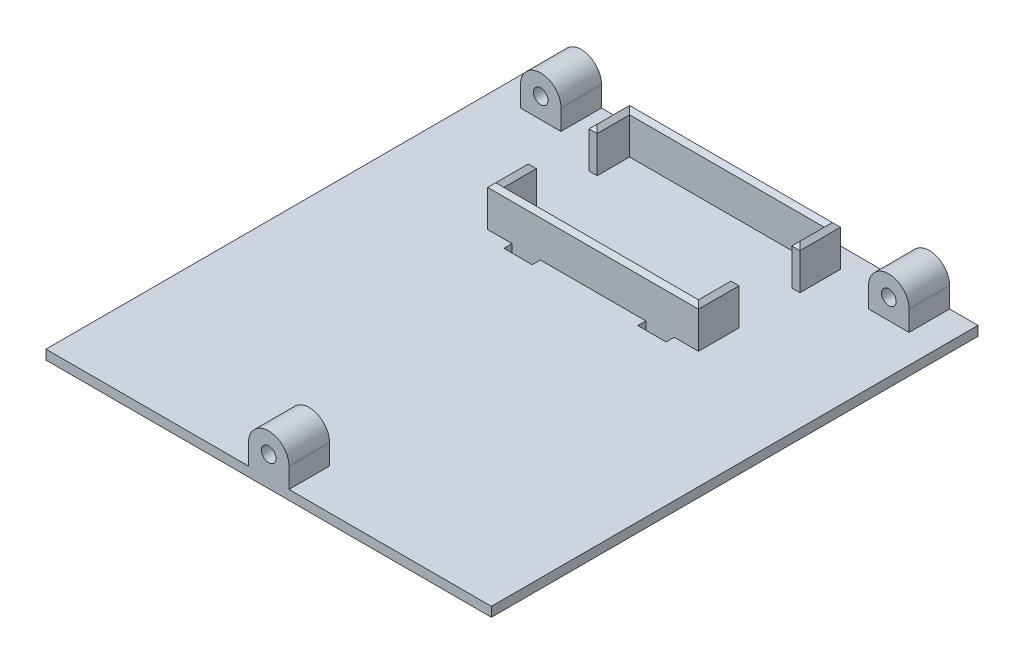
from build123d import *

# Parameters (mm, degrees)
SKETCH1_W           = 139.5
SKETCH1_H           = 152.4
BOSS_EXTRUDE1_DEPTH = 6.35
SKETCH2_W           = 139.5
SKETCH2_H           = 152.4
CUT_EXTRUDE1_DEPTH  = 3.375
SKETCH3_R           = 2.286
BOSS_EXTRUDE2_DEPTH = 12.7
SKETCH4_R           = 2.286
BOSS_EXTRUDE3_DEPTH = 12.7
BOSS_EXTRUDE4_DEPTH = 12.7
CHAMFER1_SIZE       = 1.27
SKETCH6_W           = 8.89
SKETCH6_H           = 2.54
CUT_EXTRUDE2_DEPTH  = 207.995893689


with BuildPart() as part:
    # Sketch1 → Boss-Extrude1 (new body)
    with BuildSketch(Plane(origin=(0, 0, 0), x_dir=(1, 0, 0), z_dir=(0, 1, 0))):
        with Locations((69.75, 76.2)):
            Rectangle(SKETCH1_W, SKETCH1_H)
    extrude(amount=BOSS_EXTRUDE1_DEPTH)

    # Sketch2 → Cut-Extrude1 (cut)
    with BuildSketch(Plane(origin=(0, 6.35, 0), x_dir=(1, 0, 0), z_dir=(0, 1, 0))):
        with Locations((69.75, 76.2)):
            Rectangle(SKETCH2_W, SKETCH2_H)
    extrude(amount=-CUT_EXTRUDE1_DEPTH, mode=Mode.SUBTRACT)

    # Sketch3 → Boss-Extrude2 (add)
    with BuildSketch(Plane.XY):
        with BuildLine():
            Line((63.4, 9.325), (63.4, 2.975))
            Line((63.4, 2.975), (76.1, 2.975))
            Line((76.1, 2.975), (76.1, 9.325000158))
            ThreePointArc((76.1, 9.325000158), (69.749999921, 15.675000158), (63.4, 9.325))
        make_face()
        with Locations((69.75, 9.325000158)):
            Circle(SKETCH3_R, mode=Mode.SUBTRACT)
    extrude(amount=-BOSS_EXTRUDE2_DEPTH)

    # Sketch4 → Boss-Extrude3 (add)
    # profile 1 of 2: a face of its own
    with BuildSketch(Plane(origin=(0, 0, -152.4), x_dir=(-1, 0, 0), z_dir=(0, 0, -1))):
        with BuildLine():
            Line((-130.61, 9.325), (-130.61, 2.975))
            Line((-130.61, 2.975), (-117.91, 2.975))
            Line((-117.91, 2.975), (-117.91, 9.325))
            ThreePointArc((-117.91, 9.325), (-124.26, 15.675), (-130.61, 9.325))
        make_face()
        with Locations((-124.26, 9.325)):
            Circle(SKETCH4_R, mode=Mode.SUBTRACT)
    # profile 2 of 2: a face of its own
    with BuildSketch(Plane(origin=(0, 0, -152.4), x_dir=(-1, 0, 0), z_dir=(0, 0, -1))):
        with BuildLine():
            Line((-21.59, 9.325), (-21.59, 2.975))
            Line((-21.59, 2.975), (-8.89, 2.975))
            Line((-8.89, 2.975), (-8.89, 9.325))
            ThreePointArc((-8.89, 9.325), (-15.24, 15.675), (-21.59, 9.325))
        make_face()
        with Locations((-15.24, 9.325)):
            Circle(SKETCH4_R, mode=Mode.SUBTRACT)
    extrude(amount=-BOSS_EXTRUDE3_DEPTH)

    # Sketch5 → Boss-Extrude4 (add)
    with BuildSketch(Plane(origin=(0, 2.975, 0), x_dir=(1, 0, 0), z_dir=(0, 1, 0))):
        Polygon((36.73, 146.05), (36.73, 133.35), (39.27, 133.35), (39.27, 143.51), (100.23, 143.51), (100.23, 133.35), (102.77, 133.35), (102.77, 146.05), align=None)
        Polygon((39.27, 104.14), (100.23, 104.14), (100.23, 114.3), (102.77, 114.3), (102.77, 101.6), (36.73, 101.6), (36.73, 114.3), (39.27, 114.3), align=None)
    extrude(amount=BOSS_EXTRUDE4_DEPTH)

    # Chamfer1
    chamfer1_edges = [part.edges().sort_by_distance(p)[0] for p in [
        (100.23, 15.675, -109.22),
        (69.75, 15.675, -104.14),
        (39.27, 15.675, -109.22),
        (38, 15.675, -114.3),
        (36.73, 15.675, -107.95),
        (69.75, 15.675, -101.6),
        (102.77, 15.675, -107.95),
        (101.5, 15.675, -114.3),
        (39.27, 15.675, -138.43),
        (69.75, 15.675, -143.51),
        (100.23, 15.675, -138.43),
        (101.5, 15.675, -133.35),
        (102.77, 15.675, -139.7),
        (69.75, 15.675, -146.05),
        (36.73, 15.675, -139.7),
        (38, 15.675, -133.35),
    ]]
    chamfer(chamfer1_edges, length=CHAMFER1_SIZE - 0.0001)  # a hair under: the kernel refuses the full size

    # Sketch6 → Cut-Extrude2 (cut, through all)
    with BuildSketch(Plane(origin=(0, 2.975, 0), x_dir=(1, 0, 0), z_dir=(0, 1, 0))):
        with Locations((48.795, 147.32)):
            Rectangle(SKETCH6_W, SKETCH6_H)
        with Locations((90.705, 147.32)):
            Rectangle(SKETCH6_W, SKETCH6_H)
        with Locations((48.795, 100.33)):
            Rectangle(SKETCH6_W, SKETCH6_H)
        with Locations((90.705, 100.33)):
            Rectangle(SKETCH6_W, SKETCH6_H)
    extrude(amount=-CUT_EXTRUDE2_DEPTH, mode=Mode.SUBTRACT)


solid = part.part
